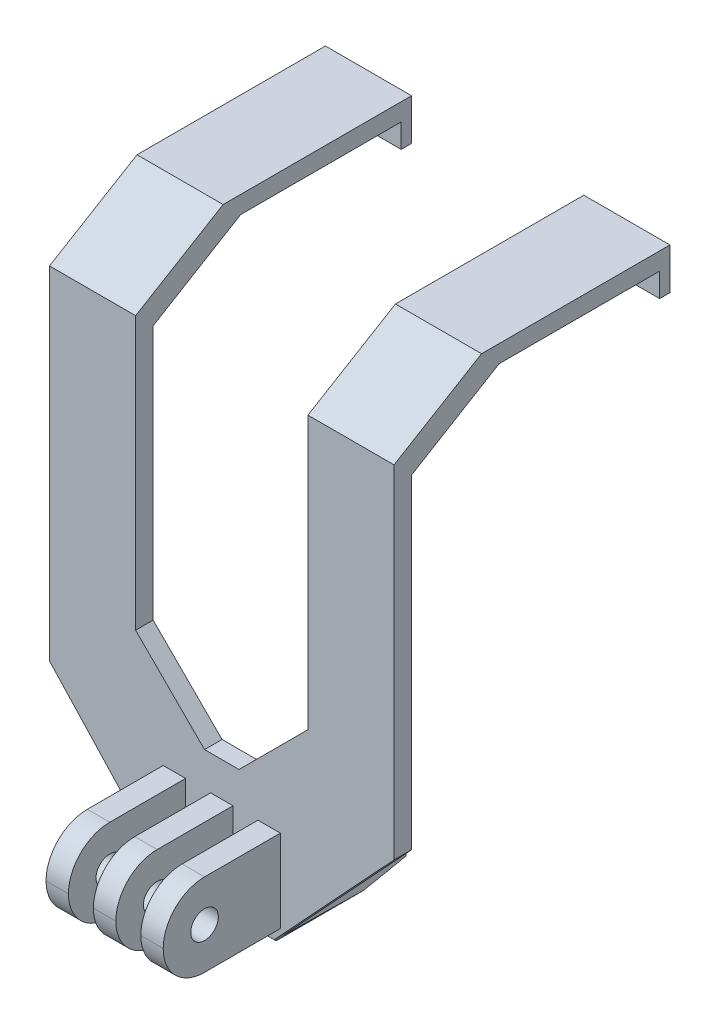
from build123d import *

# Parameters (mm, degrees)
BOSS_EXTRUDE1_DEPTH = 25
CHAMFER1_SIZE       = 7.62
CHAMFER1_SIZE2      = 12.7
CHAMFER2_SIZE       = 12.7
CHAMFER2_SIZE2      = 7.62
SKETCH2_W           = 12.5
SKETCH2_H           = 49.53232107
SKETCH2_H_2         = 15.55880868
CUT_EXTRUDE1_DEPTH  = 93.888113341
CHAMFER3_SIZE       = 10
CUT_EXTRUDE2_DEPTH  = 10
CHAMFER4_SIZE       = 4
SKETCH4_W           = 3.25
SKETCH4_H           = 12
SKETCH4_W_2         = 1.625
BOSS_EXTRUDE2_DEPTH = 17
FILLET1_R           = 6
SKETCH5_R           = 2
CUT_EXTRUDE3_DEPTH  = 96.527229626


# Some blends are built 0.0001 mm under size
with BuildPart() as part:
    # Sketch1 → Boss-Extrude1 (new, symmetric)
    with BuildSketch(Plane(origin=(0, 0, 0), x_dir=(0, 0, -1), z_dir=(1, 0, 0))):
        Polygon((2.54, 77.46), (38.54, 77.46), (38.54, 74), (40.04, 74), (40.04, 80), (0, 80), (0, 0), (24.04, 0), (24.04, 5.04), (22.54, 5.04), (22.54, 2.54), (2.54, 2.54), align=None)
    extrude(amount=BOSS_EXTRUDE1_DEPTH, both=True)

    # Chamfer1
    chamfer1_edges = [part.edges().sort_by_distance(p)[0] for p in [
        (0, 77.46, -2.54),
    ]]
    chamfer1_side = [part.faces().sort_by_distance(p)[0] for p in [
        (0, 40, -2.54),
    ]]
    chamfer(chamfer1_edges, length=CHAMFER1_SIZE, length2=CHAMFER1_SIZE2, reference=chamfer1_side[0])

    # Chamfer2
    chamfer2_edges = [part.edges().sort_by_distance(p)[0] for p in [
        (0, 80, 0),
    ]]
    chamfer2_side = [part.faces().sort_by_distance(p)[0] for p in [
        (0, 80, -20.02),
    ]]
    chamfer(chamfer2_edges, length=CHAMFER2_SIZE, length2=CHAMFER2_SIZE2, reference=chamfer2_side[0])

    # Sketch2 → Cut-Extrude1 (cut, through all)
    with BuildSketch(Plane.XY):
        Polygon((25, 0), (3.890569181, 0), (3.890569181, -6.225652432), (33.580070914, -6.225652432), (33.580070914, 22.733692281), (25, 22.733692281), align=None)
        Polygon((25, 22.733692281), (3.890569181, 0), (25, 0), align=None)
        with Locations((-6.25, 47.613839465)):
            Rectangle(SKETCH2_W, SKETCH2_H)
        with Locations((6.25, 47.613839465)):
            Rectangle(SKETCH2_W, SKETCH2_H)
        with Locations((6.25, 80.15940434)):
            Rectangle(SKETCH2_W, SKETCH2_H_2)
        with Locations((-6.25, 80.15940434)):
            Rectangle(SKETCH2_W, SKETCH2_H_2)
        Polygon((-33.580070914, 22.733692281), (-25, 22.733692281), (-3.890569181, 0), (-3.890569181, -6.225652432), (-33.580070914, -6.225652432), align=None)
    extrude(amount=-CUT_EXTRUDE1_DEPTH, mode=Mode.SUBTRACT)

    # Chamfer3
    chamfer3_edges = [part.edges().sort_by_distance(p)[0] for p in [
        (12.5, 22.84767893, -1.27),
        (-12.5, 22.84767893, -1.27),
    ]]
    chamfer(chamfer3_edges, length=CHAMFER3_SIZE)

    # Sketch3 → Cut-Extrude2 (cut)
    with BuildSketch(Plane.XZ):
        Polygon((6.24909298, -2.54), (2.09252957, -27.477990004), (-2.09252957, -27.477990004), (-6.24909298, -2.54), (-9.067628135, -2.54), (-9.067628135, -35.311562239), (9.067628135, -35.311562239), (9.067628135, -2.54), align=None)
    extrude(amount=-CUT_EXTRUDE2_DEPTH, mode=Mode.SUBTRACT)

    # Chamfer4
    # the kernel refuses this chamfer: 4 mm, written as the material it adds along each edge
    with BuildSketch(Plane(origin=(16.535824932, 2.54, -2.54), x_dir=(0, 0.9996219169112968, 0.027495876610586494), z_dir=(-1, 0, 0))) as chamfer4_piece_1_section:
        Polygon((CHAMFER4_SIZE * 0.999621916911, CHAMFER4_SIZE * 0.0274958766106), (-CHAMFER4_SIZE * 0.0274958766106, CHAMFER4_SIZE * 0.999621916911), (0, 0), align=None)
    chamfer4_piece_1 = extrude(amount=33.071649864, mode=Mode.PRIVATE)
    chamfer4_piece_1 = split(chamfer4_piece_1, bisect_by=Plane(origin=(-5.870802052, 3.874203196, -4.809619019), z_dir=(0.9863924373611449, 0, 0.16440790588271567)), keep=Keep.TOP, mode=Mode.PRIVATE)
    chamfer4_piece_1 = split(chamfer4_piece_1, bisect_by=Plane(origin=(5.870802052, 3.874203196, -4.809619019), z_dir=(-0.9863924373611449, 0, 0.16440790588271567)), keep=Keep.TOP, mode=Mode.PRIVATE)
    add(chamfer4_piece_1)
    # the kernel refuses this chamfer: 4 mm, written as the material it takes off along each edge
    with BuildSketch(Plane(origin=(-14.177301133, 0, 0), x_dir=(0, 0.9996219169112968, 0.027495876610586372), z_dir=(1, 0, 0))) as chamfer4_2_piece_1:
        Polygon((CHAMFER4_SIZE * 0.999621916911, -CHAMFER4_SIZE * 0.0274958766106), (-CHAMFER4_SIZE * 0.0274958766106, -CHAMFER4_SIZE * 0.999621916911), (0, 0), align=None)
    extrude(amount=28.354602266, mode=Mode.SUBTRACT)

    # Sketch4 → Boss-Extrude2 (add)
    with BuildSketch(Plane.XY):
        with Locations((-6.875, 11.84767893)):
            Rectangle(SKETCH4_W, SKETCH4_H)
        with Locations((0.8125, 11.84767893)):
            Rectangle(SKETCH4_W_2, SKETCH4_H)
        with Locations((-0.8125, 11.84767893)):
            Rectangle(SKETCH4_W_2, SKETCH4_H)
        with Locations((6.875, 11.84767893)):
            Rectangle(SKETCH4_W, SKETCH4_H)
    extrude(amount=BOSS_EXTRUDE2_DEPTH)

    # Fillet1
    fillet1_edges = [part.edges().sort_by_distance(p)[0] for p in [
        (-6.875, 5.84767893, 17),
        (0, 5.84767893, 17),
        (6.875, 5.84767893, 17),
        (6.875, 17.84767893, 17),
        (0, 17.84767893, 17),
        (-6.875, 17.84767893, 17),
    ]]
    fillet(fillet1_edges, radius=FILLET1_R - 0.0001)  # a hair under: the kernel refuses the full size

    # Sketch5 → Cut-Extrude3 (cut, through all)
    with BuildSketch(Plane(origin=(8.5, 0, 0), x_dir=(0, 0, -1), z_dir=(1, 0, 0))):
        with Locations((-11, 11.84767893)):
            Circle(SKETCH5_R)
    extrude(amount=-CUT_EXTRUDE3_DEPTH, mode=Mode.SUBTRACT)


solid = part.part
